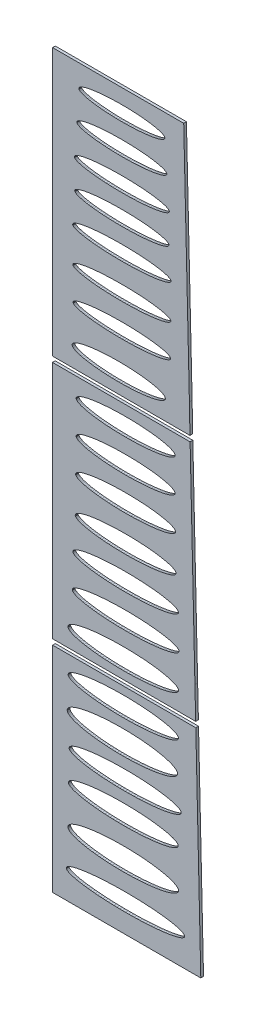
from build123d import *

# Parameters (mm, degrees)
EXTRUDE_1_DEPTH   = 1
EXTRUDE_1_2_DEPTH = 1
EXTRUDE_1_3_DEPTH = 1


with BuildPart() as part:
    # Model → 凸台-拉伸1 (new body)
    with BuildSketch(Plane.XY):
        Polygon((684.864186358, 730.85841127), (686.635417008, 654.440492915), (686.915945772, 642.85841127), (634.318878332, 642.85841127), (634.268367354, 730.85841127), align=None)
        Polygon((679.367985793, 723.772596316), (679.347985793, 723.611596316), (679.277985793, 723.452596316), (679.167985793, 723.293596316), (679.017985793, 723.135596316), (678.827985793, 722.979596316), (678.587985793, 722.824596316), (678.307985793, 722.672596316), (677.977985793, 722.523596316), (677.617985793, 722.376596316), (677.217985793, 722.233596316), (676.777985793, 722.094596316), (676.297985793, 721.958596316), (675.787985793, 721.827596316), (675.237985793, 721.701596316), (674.647985793, 721.580596316), (674.037985793, 721.464596316), (673.387985793, 721.353596316), (672.707985793, 721.249596316), (672.007985793, 721.150596316), (671.277985793, 721.058596316), (670.517985793, 720.972596316), (669.747985793, 720.893596316), (668.947985793, 720.821596316), (668.127985793, 720.756596316), (667.297985793, 720.699596316), (666.447985793, 720.648596316), (665.587985793, 720.606596316), (664.717985793, 720.570596316), (663.837985793, 720.543596316), (662.947985793, 720.523596316), (662.057985793, 720.512596316), (661.157985793, 720.508596316), (660.267985793, 720.512596316), (659.377985793, 720.523596316), (658.487985793, 720.543596316), (657.607985793, 720.570596316), (656.737985793, 720.606596316), (655.877985793, 720.648596316), (655.027985793, 720.699596316), (654.197985793, 720.756596316), (653.377985793, 720.821596316), (652.577985793, 720.893596316), (651.797985793, 720.972596316), (651.047985793, 721.058596316), (650.317985793, 721.150596316), (649.607985793, 721.249596316), (648.937985793, 721.353596316), (648.287985793, 721.464596316), (647.667985793, 721.580596316), (647.087985793, 721.701596316), (646.537985793, 721.827596316), (646.027985793, 721.958596316), (645.547985793, 722.094596316), (645.107985793, 722.233596316), (644.707985793, 722.376596316), (644.337985793, 722.523596316), (644.017985793, 722.672596316), (643.737985793, 722.824596316), (643.497985793, 722.979596316), (643.307985793, 723.135596316), (643.157985793, 723.293596316), (643.047985793, 723.452596316), (642.977985793, 723.611596316), (642.957985793, 723.772596316), (642.977985793, 723.932596316), (643.047985793, 724.091596316), (643.157985793, 724.250596316), (643.307985793, 724.408596316), (643.497985793, 724.565596316), (643.737985793, 724.719596316), (644.017985793, 724.871596316), (644.337985793, 725.021596316), (644.707985793, 725.167596316), (645.107985793, 725.310596316), (645.547985793, 725.449596316), (646.027985793, 725.585596316), (646.537985793, 725.716596316), (647.087985793, 725.842596316), (647.667985793, 725.963596316), (648.287985793, 726.079596316), (648.937985793, 726.190596316), (649.607985793, 726.294596316), (650.317985793, 726.393596316), (651.047985793, 726.485596316), (651.797985793, 726.571596316), (652.577985793, 726.650596316), (653.377985793, 726.722596316), (654.197985793, 726.787596316), (655.027985793, 726.845596316), (655.877985793, 726.895596316), (656.737985793, 726.938596316), (657.607985793, 726.973596316), (658.487985793, 727.000596316), (659.377985793, 727.020596316), (660.267985793, 727.031596316), (661.157985793, 727.035596316), (662.057985793, 727.031596316), (662.947985793, 727.020596316), (663.837985793, 727.000596316), (664.717985793, 726.973596316), (665.587985793, 726.938596316), (666.447985793, 726.895596316), (667.297985793, 726.845596316), (668.127985793, 726.787596316), (668.947985793, 726.722596316), (669.747985793, 726.650596316), (670.517985793, 726.571596316), (671.277985793, 726.485596316), (672.007985793, 726.393596316), (672.707985793, 726.294596316), (673.387985793, 726.190596316), (674.037985793, 726.079596316), (674.647985793, 725.963596316), (675.237985793, 725.842596316), (675.787985793, 725.716596316), (676.297985793, 725.585596316), (676.777985793, 725.449596316), (677.217985793, 725.310596316), (677.617985793, 725.167596316), (677.977985793, 725.021596316), (678.307985793, 724.871596316), (678.587985793, 724.719596316), (678.827985793, 724.565596316), (679.017985793, 724.408596316), (679.167985793, 724.250596316), (679.277985793, 724.091596316), (679.347985793, 723.932596316), align=None, mode=Mode.SUBTRACT)
        Polygon((679.367985793, 711.713596316), (679.347985793, 711.553596316), (679.277985793, 711.393596316), (679.167985793, 711.235596316), (679.017985793, 711.077596316), (678.827985793, 710.920596316), (678.587985793, 710.766596316), (678.307985793, 710.614596316), (677.977985793, 710.464596316), (677.617985793, 710.318596316), (677.217985793, 710.175596316), (676.777985793, 710.035596316), (676.297985793, 709.900596316), (675.787985793, 709.769596316), (675.237985793, 709.643596316), (674.647985793, 709.522596316), (674.037985793, 709.406596316), (673.387985793, 709.295596316), (672.707985793, 709.190596316), (672.007985793, 709.092596316), (671.277985793, 709.000596316), (670.517985793, 708.914596316), (669.747985793, 708.835596316), (668.947985793, 708.763596316), (668.127985793, 708.698596316), (667.297985793, 708.640596316), (666.447985793, 708.590596316), (665.587985793, 708.547596316), (664.717985793, 708.512596316), (663.837985793, 708.485596316), (662.947985793, 708.465596316), (662.057985793, 708.454596316), (661.157985793, 708.450596316), (660.267985793, 708.454596316), (659.377985793, 708.465596316), (658.487985793, 708.485596316), (657.607985793, 708.512596316), (656.737985793, 708.547596316), (655.877985793, 708.590596316), (655.027985793, 708.640596316), (654.197985793, 708.698596316), (653.377985793, 708.763596316), (652.577985793, 708.835596316), (651.797985793, 708.914596316), (651.047985793, 709.000596316), (650.317985793, 709.092596316), (649.607985793, 709.190596316), (648.937985793, 709.295596316), (648.287985793, 709.406596316), (647.667985793, 709.522596316), (647.087985793, 709.643596316), (646.537985793, 709.769596316), (646.027985793, 709.900596316), (645.547985793, 710.035596316), (645.107985793, 710.175596316), (644.707985793, 710.318596316), (644.337985793, 710.464596316), (644.017985793, 710.614596316), (643.737985793, 710.766596316), (643.497985793, 710.920596316), (643.307985793, 711.077596316), (643.157985793, 711.235596316), (643.047985793, 711.393596316), (642.977985793, 711.553596316), (642.957985793, 711.713596316), (642.977985793, 711.874596316), (643.047985793, 712.033596316), (643.157985793, 712.192596316), (643.307985793, 712.350596316), (643.497985793, 712.506596316), (643.737985793, 712.661596316), (644.017985793, 712.813596316), (644.337985793, 712.962596316), (644.707985793, 713.109596316), (645.107985793, 713.252596316), (645.547985793, 713.391596316), (646.027985793, 713.527596316), (646.537985793, 713.658596316), (647.087985793, 713.784596316), (647.667985793, 713.905596316), (648.287985793, 714.021596316), (648.937985793, 714.132596316), (649.607985793, 714.236596316), (650.317985793, 714.335596316), (651.047985793, 714.427596316), (651.797985793, 714.513596316), (652.577985793, 714.592596316), (653.377985793, 714.664596316), (654.197985793, 714.729596316), (655.027985793, 714.786596316), (655.877985793, 714.837596316), (656.737985793, 714.879596316), (657.607985793, 714.914596316), (658.487985793, 714.942596316), (659.377985793, 714.961596316), (660.267985793, 714.973596316), (661.157985793, 714.977596316), (662.057985793, 714.973596316), (662.947985793, 714.961596316), (663.837985793, 714.942596316), (664.717985793, 714.914596316), (665.587985793, 714.879596316), (666.447985793, 714.837596316), (667.297985793, 714.786596316), (668.127985793, 714.729596316), (668.947985793, 714.664596316), (669.747985793, 714.592596316), (670.517985793, 714.513596316), (671.277985793, 714.427596316), (672.007985793, 714.335596316), (672.707985793, 714.236596316), (673.387985793, 714.132596316), (674.037985793, 714.021596316), (674.647985793, 713.905596316), (675.237985793, 713.784596316), (675.787985793, 713.658596316), (676.297985793, 713.527596316), (676.777985793, 713.391596316), (677.217985793, 713.252596316), (677.617985793, 713.109596316), (677.977985793, 712.962596316), (678.307985793, 712.813596316), (678.587985793, 712.661596316), (678.827985793, 712.506596316), (679.017985793, 712.350596316), (679.167985793, 712.192596316), (679.277985793, 712.033596316), (679.347985793, 711.874596316), align=None, mode=Mode.SUBTRACT)
        Polygon((679.537985793, 699.534517948), (679.517985793, 699.373517948), (679.447985793, 699.214517948), (679.337985793, 699.055517948), (679.177985793, 698.897517948), (678.987985793, 698.741517948), (678.747985793, 698.586517948), (678.457985793, 698.434517948), (678.137985793, 698.285517948), (677.767985793, 698.138517948), (677.367985793, 697.995517948), (676.917985793, 697.856517948), (676.437985793, 697.720517948), (675.917985793, 697.589517948), (675.367985793, 697.463517948), (674.777985793, 697.342517948), (674.157985793, 697.226517948), (673.497985793, 697.115517948), (672.817985793, 697.011517948), (672.107985793, 696.912517948), (671.367985793, 696.820517948), (670.607985793, 696.734517948), (669.827985793, 696.655517948), (669.017985793, 696.583517948), (668.197985793, 696.518517948), (667.347985793, 696.461517948), (666.497985793, 696.410517948), (665.627985793, 696.368517948), (664.747985793, 696.333517948), (663.857985793, 696.305517948), (662.967985793, 696.286517948), (662.067985793, 696.274517948), (661.157985793, 696.270517948), (660.257985793, 696.274517948), (659.357985793, 696.286517948), (658.467985793, 696.305517948), (657.577985793, 696.333517948), (656.697985793, 696.368517948), (655.827985793, 696.410517948), (654.967985793, 696.461517948), (654.127985793, 696.518517948), (653.307985793, 696.583517948), (652.497985793, 696.655517948), (651.717985793, 696.734517948), (650.957985793, 696.820517948), (650.217985793, 696.912517948), (649.507985793, 697.011517948), (648.827985793, 697.115517948), (648.167985793, 697.226517948), (647.547985793, 697.342517948), (646.957985793, 697.463517948), (646.407985793, 697.589517948), (645.887985793, 697.720517948), (645.407985793, 697.856517948), (644.957985793, 697.995517948), (644.557985793, 698.138517948), (644.187985793, 698.285517948), (643.867985793, 698.434517948), (643.577985793, 698.586517948), (643.337985793, 698.741517948), (643.137985793, 698.897517948), (642.987985793, 699.055517948), (642.877985793, 699.214517948), (642.807985793, 699.373517948), (642.787985793, 699.534517948), (642.807985793, 699.694517948), (642.877985793, 699.853517948), (642.987985793, 700.012517948), (643.137985793, 700.170517948), (643.337985793, 700.327517948), (643.577985793, 700.481517948), (643.867985793, 700.633517948), (644.187985793, 700.783517948), (644.557985793, 700.929517948), (644.957985793, 701.072517948), (645.407985793, 701.211517948), (645.887985793, 701.347517948), (646.407985793, 701.478517948), (646.957985793, 701.604517948), (647.547985793, 701.725517948), (648.167985793, 701.841517948), (648.827985793, 701.952517948), (649.507985793, 702.056517948), (650.217985793, 702.155517948), (650.957985793, 702.247517948), (651.717985793, 702.333517948), (652.497985793, 702.412517948), (653.307985793, 702.484517948), (654.127985793, 702.549517948), (654.967985793, 702.607517948), (655.827985793, 702.657517948), (656.697985793, 702.700517948), (657.577985793, 702.735517948), (658.467985793, 702.762517948), (659.357985793, 702.782517948), (660.257985793, 702.793517948), (661.157985793, 702.797517948), (662.067985793, 702.793517948), (662.967985793, 702.782517948), (663.857985793, 702.762517948), (664.747985793, 702.735517948), (665.627985793, 702.700517948), (666.497985793, 702.657517948), (667.347985793, 702.607517948), (668.197985793, 702.549517948), (669.017985793, 702.484517948), (669.827985793, 702.412517948), (670.607985793, 702.333517948), (671.367985793, 702.247517948), (672.107985793, 702.155517948), (672.817985793, 702.056517948), (673.497985793, 701.952517948), (674.157985793, 701.841517948), (674.777985793, 701.725517948), (675.367985793, 701.604517948), (675.917985793, 701.478517948), (676.437985793, 701.347517948), (676.917985793, 701.211517948), (677.367985793, 701.072517948), (677.767985793, 700.929517948), (678.137985793, 700.783517948), (678.457985793, 700.633517948), (678.747985793, 700.481517948), (678.987985793, 700.327517948), (679.177985793, 700.170517948), (679.337985793, 700.012517948), (679.447985793, 699.853517948), (679.517985793, 699.694517948), align=None, mode=Mode.SUBTRACT)
        Polygon((679.697985793, 686.423478764), (679.677985793, 686.263478764), (679.617985793, 686.103478764), (679.497985793, 685.944478764), (679.347985793, 685.786478764), (679.147985793, 685.630478764), (678.907985793, 685.476478764), (678.617985793, 685.323478764), (678.287985793, 685.174478764), (677.917985793, 685.028478764), (677.517985793, 684.884478764), (677.067985793, 684.745478764), (676.577985793, 684.610478764), (676.057985793, 684.479478764), (675.497985793, 684.353478764), (674.897985793, 684.231478764), (674.267985793, 684.115478764), (673.617985793, 684.005478764), (672.927985793, 683.900478764), (672.207985793, 683.802478764), (671.457985793, 683.709478764), (670.697985793, 683.624478764), (669.897985793, 683.545478764), (669.087985793, 683.473478764), (668.257985793, 683.408478764), (667.407985793, 683.350478764), (666.547985793, 683.300478764), (665.667985793, 683.257478764), (664.777985793, 683.222478764), (663.877985793, 683.195478764), (662.977985793, 683.175478764), (662.067985793, 683.163478764), (661.157985793, 683.159478764), (660.247985793, 683.163478764), (659.347985793, 683.175478764), (658.437985793, 683.195478764), (657.547985793, 683.222478764), (656.657985793, 683.257478764), (655.777985793, 683.300478764), (654.917985793, 683.350478764), (654.067985793, 683.408478764), (653.237985793, 683.473478764), (652.417985793, 683.545478764), (651.627985793, 683.624478764), (650.857985793, 683.709478764), (650.117985793, 683.802478764), (649.397985793, 683.900478764), (648.707985793, 684.005478764), (648.047985793, 684.115478764), (647.427985793, 684.231478764), (646.827985793, 684.353478764), (646.267985793, 684.479478764), (645.747985793, 684.610478764), (645.257985793, 684.745478764), (644.807985793, 684.884478764), (644.397985793, 685.028478764), (644.037985793, 685.174478764), (643.707985793, 685.323478764), (643.417985793, 685.476478764), (643.177985793, 685.630478764), (642.977985793, 685.786478764), (642.827985793, 685.944478764), (642.707985793, 686.103478764), (642.647985793, 686.263478764), (642.617985793, 686.423478764), (642.647985793, 686.583478764), (642.707985793, 686.743478764), (642.827985793, 686.902478764), (642.977985793, 687.060478764), (643.177985793, 687.216478764), (643.417985793, 687.370478764), (643.707985793, 687.523478764), (644.037985793, 687.672478764), (644.397985793, 687.818478764), (644.807985793, 687.962478764), (645.257985793, 688.101478764), (645.747985793, 688.236478764), (646.267985793, 688.367478764), (646.827985793, 688.494478764), (647.427985793, 688.615478764), (648.047985793, 688.731478764), (648.707985793, 688.841478764), (649.397985793, 688.946478764), (650.117985793, 689.045478764), (650.857985793, 689.137478764), (651.627985793, 689.222478764), (652.417985793, 689.301478764), (653.237985793, 689.373478764), (654.067985793, 689.438478764), (654.917985793, 689.496478764), (655.777985793, 689.546478764), (656.657985793, 689.589478764), (657.547985793, 689.624478764), (658.437985793, 689.651478764), (659.347985793, 689.671478764), (660.247985793, 689.683478764), (661.157985793, 689.687478764), (662.067985793, 689.683478764), (662.977985793, 689.671478764), (663.877985793, 689.651478764), (664.777985793, 689.624478764), (665.667985793, 689.589478764), (666.547985793, 689.546478764), (667.407985793, 689.496478764), (668.257985793, 689.438478764), (669.087985793, 689.373478764), (669.897985793, 689.301478764), (670.697985793, 689.222478764), (671.457985793, 689.137478764), (672.207985793, 689.045478764), (672.927985793, 688.946478764), (673.617985793, 688.841478764), (674.267985793, 688.731478764), (674.897985793, 688.615478764), (675.497985793, 688.494478764), (676.057985793, 688.367478764), (676.577985793, 688.236478764), (677.067985793, 688.101478764), (677.517985793, 687.962478764), (677.917985793, 687.818478764), (678.287985793, 687.672478764), (678.617985793, 687.523478764), (678.907985793, 687.370478764), (679.147985793, 687.216478764), (679.347985793, 687.060478764), (679.497985793, 686.902478764), (679.617985793, 686.743478764), (679.677985793, 686.583478764), align=None, mode=Mode.SUBTRACT)
        Polygon((680.597985793, 674.382361212), (680.567985793, 674.222361212), (680.497985793, 674.063361212), (680.377985793, 673.904361212), (680.217985793, 673.746361212), (680.007985793, 673.589361212), (679.757985793, 673.435361212), (679.457985793, 673.283361212), (679.117985793, 673.133361212), (678.727985793, 672.987361212), (678.297985793, 672.844361212), (677.827985793, 672.705361212), (677.317985793, 672.569361212), (676.767985793, 672.438361212), (676.177985793, 672.312361212), (675.557985793, 672.191361212), (674.897985793, 672.075361212), (674.207985793, 671.964361212), (673.487985793, 671.860361212), (672.737985793, 671.761361212), (671.957985793, 671.669361212), (671.147985793, 671.583361212), (670.317985793, 671.504361212), (669.467985793, 671.432361212), (668.597985793, 671.367361212), (667.707985793, 671.309361212), (666.797985793, 671.259361212), (665.887985793, 671.217361212), (664.957985793, 671.181361212), (664.017985793, 671.154361212), (663.067985793, 671.134361212), (662.117985793, 671.123361212), (661.157985793, 671.119361212), (660.207985793, 671.123361212), (659.257985793, 671.134361212), (658.307985793, 671.154361212), (657.367985793, 671.181361212), (656.437985793, 671.217361212), (655.517985793, 671.259361212), (654.617985793, 671.309361212), (653.727985793, 671.367361212), (652.857985793, 671.432361212), (652.007985793, 671.504361212), (651.177985793, 671.583361212), (650.367985793, 671.669361212), (649.587985793, 671.761361212), (648.837985793, 671.860361212), (648.117985793, 671.964361212), (647.427985793, 672.075361212), (646.767985793, 672.191361212), (646.137985793, 672.312361212), (645.557985793, 672.438361212), (645.007985793, 672.569361212), (644.497985793, 672.705361212), (644.027985793, 672.844361212), (643.597985793, 672.987361212), (643.207985793, 673.133361212), (642.867985793, 673.283361212), (642.567985793, 673.435361212), (642.317985793, 673.589361212), (642.107985793, 673.746361212), (641.937985793, 673.904361212), (641.827985793, 674.063361212), (641.757985793, 674.222361212), (641.727985793, 674.382361212), (641.757985793, 674.543361212), (641.827985793, 674.702361212), (641.937985793, 674.861361212), (642.107985793, 675.019361212), (642.317985793, 675.175361212), (642.567985793, 675.330361212), (642.867985793, 675.482361212), (643.207985793, 675.631361212), (643.597985793, 675.778361212), (644.027985793, 675.921361212), (644.497985793, 676.060361212), (645.007985793, 676.196361212), (645.557985793, 676.327361212), (646.137985793, 676.453361212), (646.767985793, 676.574361212), (647.427985793, 676.690361212), (648.117985793, 676.801361212), (648.837985793, 676.905361212), (649.587985793, 677.004361212), (650.367985793, 677.096361212), (651.177985793, 677.182361212), (652.007985793, 677.261361212), (652.857985793, 677.333361212), (653.727985793, 677.398361212), (654.617985793, 677.455361212), (655.517985793, 677.506361212), (656.437985793, 677.548361212), (657.367985793, 677.584361212), (658.307985793, 677.611361212), (659.257985793, 677.631361212), (660.207985793, 677.642361212), (661.157985793, 677.646361212), (662.117985793, 677.642361212), (663.067985793, 677.631361212), (664.017985793, 677.611361212), (664.957985793, 677.584361212), (665.887985793, 677.548361212), (666.797985793, 677.506361212), (667.707985793, 677.455361212), (668.597985793, 677.398361212), (669.467985793, 677.333361212), (670.317985793, 677.261361212), (671.147985793, 677.182361212), (671.957985793, 677.096361212), (672.737985793, 677.004361212), (673.487985793, 676.905361212), (674.207985793, 676.801361212), (674.897985793, 676.690361212), (675.557985793, 676.574361212), (676.177985793, 676.453361212), (676.767985793, 676.327361212), (677.317985793, 676.196361212), (677.827985793, 676.060361212), (678.297985793, 675.921361212), (678.727985793, 675.778361212), (679.117985793, 675.631361212), (679.457985793, 675.482361212), (679.757985793, 675.330361212), (680.007985793, 675.175361212), (680.217985793, 675.019361212), (680.377985793, 674.861361212), (680.497985793, 674.702361212), (680.567985793, 674.543361212), align=None, mode=Mode.SUBTRACT)
        Polygon((680.787985793, 662.12624366), (680.767985793, 661.96624366), (680.697985793, 661.80624366), (680.577985793, 661.64724366), (680.417985793, 661.49024366), (680.207985793, 661.33324366), (679.947985793, 661.17924366), (679.647985793, 661.02724366), (679.297985793, 660.87724366), (678.907985793, 660.73124366), (678.477985793, 660.58824366), (677.997985793, 660.44824366), (677.487985793, 660.31324366), (676.927985793, 660.18224366), (676.337985793, 660.05624366), (675.707985793, 659.93524366), (675.037985793, 659.81924366), (674.347985793, 659.70824366), (673.617985793, 659.60324366), (672.857985793, 659.50524366), (672.067985793, 659.41324366), (671.257985793, 659.32724366), (670.417985793, 659.24824366), (669.557985793, 659.17624366), (668.677985793, 659.11124366), (667.777985793, 659.05324366), (666.857985793, 659.00324366), (665.927985793, 658.96024366), (664.987985793, 658.92524366), (664.037985793, 658.89824366), (663.087985793, 658.87824366), (662.127985793, 658.86724366), (661.157985793, 658.86324366), (660.197985793, 658.86724366), (659.237985793, 658.87824366), (658.277985793, 658.89824366), (657.337985793, 658.92524366), (656.397985793, 658.96024366), (655.467985793, 659.00324366), (654.547985793, 659.05324366), (653.647985793, 659.11124366), (652.767985793, 659.17624366), (651.907985793, 659.24824366), (651.067985793, 659.32724366), (650.257985793, 659.41324366), (649.467985793, 659.50524366), (648.707985793, 659.60324366), (647.977985793, 659.70824366), (647.277985793, 659.81924366), (646.617985793, 659.93524366), (645.987985793, 660.05624366), (645.397985793, 660.18224366), (644.837985793, 660.31324366), (644.327985793, 660.44824366), (643.847985793, 660.58824366), (643.417985793, 660.73124366), (643.027985793, 660.87724366), (642.677985793, 661.02724366), (642.377985793, 661.17924366), (642.117985793, 661.33324366), (641.907985793, 661.49024366), (641.747985793, 661.64724366), (641.627985793, 661.80624366), (641.557985793, 661.96624366), (641.537985793, 662.12624366), (641.557985793, 662.28624366), (641.627985793, 662.44624366), (641.747985793, 662.60524366), (641.907985793, 662.76324366), (642.117985793, 662.91924366), (642.377985793, 663.07424366), (642.677985793, 663.22624366), (643.027985793, 663.37524366), (643.417985793, 663.52224366), (643.847985793, 663.66524366), (644.327985793, 663.80424366), (644.837985793, 663.94024366), (645.397985793, 664.07124366), (645.987985793, 664.19724366), (646.617985793, 664.31824366), (647.277985793, 664.43424366), (647.977985793, 664.54524366), (648.707985793, 664.64924366), (649.467985793, 664.74824366), (650.257985793, 664.84024366), (651.067985793, 664.92624366), (651.907985793, 665.00524366), (652.767985793, 665.07724366), (653.647985793, 665.14224366), (654.547985793, 665.19924366), (655.467985793, 665.25024366), (656.397985793, 665.29224366), (657.337985793, 665.32724366), (658.277985793, 665.35524366), (659.237985793, 665.37424366), (660.197985793, 665.38624366), (661.157985793, 665.39024366), (662.127985793, 665.38624366), (663.087985793, 665.37424366), (664.037985793, 665.35524366), (664.987985793, 665.32724366), (665.927985793, 665.29224366), (666.857985793, 665.25024366), (667.777985793, 665.19924366), (668.677985793, 665.14224366), (669.557985793, 665.07724366), (670.417985793, 665.00524366), (671.257985793, 664.92624366), (672.067985793, 664.84024366), (672.857985793, 664.74824366), (673.617985793, 664.64924366), (674.347985793, 664.54524366), (675.037985793, 664.43424366), (675.707985793, 664.31824366), (676.337985793, 664.19724366), (676.927985793, 664.07124366), (677.487985793, 663.94024366), (677.997985793, 663.80424366), (678.477985793, 663.66524366), (678.907985793, 663.52224366), (679.297985793, 663.37524366), (679.647985793, 663.22624366), (679.947985793, 663.07424366), (680.207985793, 662.91924366), (680.417985793, 662.76324366), (680.577985793, 662.60524366), (680.697985793, 662.44624366), (680.767985793, 662.28624366), align=None, mode=Mode.SUBTRACT)
        Polygon((639.906209286, 649.576387755), (639.926209286, 649.763387755), (640.006209286, 649.949387755), (640.126209286, 650.135387755), (640.296209286, 650.319387755), (640.516209286, 650.502387755), (640.786209286, 650.682387755), (641.096209286, 650.860387755), (641.456209286, 651.035387755), (641.856209286, 651.206387755), (642.306209286, 651.373387755), (642.796209286, 651.536387755), (643.336209286, 651.694387755), (643.906209286, 651.847387755), (644.526209286, 651.994387755), (645.176209286, 652.136387755), (645.866209286, 652.272387755), (646.586209286, 652.401387755), (647.346209286, 652.523387755), (648.136209286, 652.638387755), (648.946209286, 652.746387755), (649.796209286, 652.846387755), (650.666209286, 652.938387755), (651.556209286, 653.022387755), (652.466209286, 653.098387755), (653.396209286, 653.165387755), (654.346209286, 653.224387755), (655.306209286, 653.274387755), (656.286209286, 653.315387755), (657.266209286, 653.347387755), (658.256209286, 653.370387755), (659.256209286, 653.384387755), (660.256209286, 653.388387755), (661.256209286, 653.384387755), (662.246209286, 653.370387755), (663.236209286, 653.347387755), (664.226209286, 653.315387755), (665.196209286, 653.274387755), (666.166209286, 653.224387755), (667.106209286, 653.165387755), (668.046209286, 653.098387755), (668.956209286, 653.022387755), (669.846209286, 652.938387755), (670.716209286, 652.846387755), (671.556209286, 652.746387755), (672.376209286, 652.638387755), (673.166209286, 652.523387755), (673.916209286, 652.401387755), (674.646209286, 652.272387755), (675.336209286, 652.136387755), (675.986209286, 651.994387755), (676.596209286, 651.847387755), (677.176209286, 651.694387755), (677.706209286, 651.536387755), (678.196209286, 651.373387755), (678.646209286, 651.206387755), (679.056209286, 651.035387755), (679.416209286, 650.860387755), (679.726209286, 650.682387755), (679.996209286, 650.502387755), (680.216209286, 650.319387755), (680.386209286, 650.135387755), (680.506209286, 649.949387755), (680.576209286, 649.763387755), (680.606209286, 649.576387755), (680.576209286, 649.389387755), (680.506209286, 649.202387755), (680.386209286, 649.016387755), (680.216209286, 648.832387755), (679.996209286, 648.649387755), (679.726209286, 648.469387755), (679.416209286, 648.291387755), (679.056209286, 648.117387755), (678.646209286, 647.945387755), (678.196209286, 647.778387755), (677.706209286, 647.616387755), (677.176209286, 647.457387755), (676.596209286, 647.304387755), (675.986209286, 647.157387755), (675.336209286, 647.015387755), (674.646209286, 646.880387755), (673.916209286, 646.751387755), (673.166209286, 646.628387755), (672.376209286, 646.513387755), (671.556209286, 646.406387755), (670.716209286, 646.305387755), (669.846209286, 646.213387755), (668.956209286, 646.129387755), (668.046209286, 646.053387755), (667.106209286, 645.986387755), (666.166209286, 645.927387755), (665.196209286, 645.877387755), (664.226209286, 645.836387755), (663.236209286, 645.804387755), (662.246209286, 645.781387755), (661.256209286, 645.768387755), (660.256209286, 645.763387755), (659.256209286, 645.768387755), (658.256209286, 645.781387755), (657.266209286, 645.804387755), (656.286209286, 645.836387755), (655.306209286, 645.877387755), (654.346209286, 645.927387755), (653.396209286, 645.986387755), (652.466209286, 646.053387755), (651.556209286, 646.129387755), (650.666209286, 646.213387755), (649.796209286, 646.305387755), (648.946209286, 646.406387755), (648.136209286, 646.513387755), (647.346209286, 646.628387755), (646.586209286, 646.751387755), (645.866209286, 646.880387755), (645.176209286, 647.015387755), (644.526209286, 647.157387755), (643.906209286, 647.304387755), (643.336209286, 647.457387755), (642.796209286, 647.616387755), (642.306209286, 647.778387755), (641.856209286, 647.945387755), (641.456209286, 648.117387755), (641.096209286, 648.291387755), (640.786209286, 648.469387755), (640.516209286, 648.649387755), (640.296209286, 648.832387755), (640.126209286, 649.016387755), (640.006209286, 649.202387755), (639.926209286, 649.389387755), align=None, mode=Mode.SUBTRACT)
    extrude(amount=EXTRUDE_1_DEPTH)


with BuildPart() as body_2:
    # Model → Extrude 1 2 (new body)
    with BuildSketch(Plane.XY):
        Polygon((634.268367354, 732.85841127), (684.802380972, 732.85841127), (684.604210693, 743.48369558), (682.512393372, 831.108332524), (634.307655364, 831.108332524), align=None)
        Polygon((675.77913377, 740.070596316), (675.75913377, 739.910596316), (675.69913377, 739.750596316), (675.59913377, 739.592596316), (675.44913377, 739.434596316), (675.26913377, 739.277596316), (675.03913377, 739.123596316), (674.77913377, 738.971596316), (674.47913377, 738.821596316), (674.12913377, 738.675596316), (673.75913377, 738.532596316), (673.33913377, 738.392596316), (672.88913377, 738.257596316), (672.40913377, 738.126596316), (671.88913377, 738.000596316), (671.33913377, 737.879596316), (670.75913377, 737.763596316), (670.14913377, 737.652596316), (669.50913377, 737.547596316), (668.84913377, 737.449596316), (668.15913377, 737.357596316), (667.44913377, 737.271596316), (666.70913377, 737.192596316), (665.95913377, 737.120596316), (665.18913377, 737.055596316), (664.40913377, 736.997596316), (663.60913377, 736.947596316), (662.79913377, 736.904596316), (661.97913377, 736.869596316), (661.14913377, 736.842596316), (660.30913377, 736.822596316), (659.46913377, 736.811596316), (658.62913377, 736.807596316), (657.78913377, 736.811596316), (656.94913377, 736.822596316), (656.10913377, 736.842596316), (655.27913377, 736.869596316), (654.45913377, 736.904596316), (653.64913377, 736.947596316), (652.84913377, 736.997596316), (652.06913377, 737.055596316), (651.29913377, 737.120596316), (650.53913377, 737.192596316), (649.80913377, 737.271596316), (649.09913377, 737.357596316), (648.40913377, 737.449596316), (647.74913377, 737.547596316), (647.10913377, 737.652596316), (646.49913377, 737.763596316), (645.91913377, 737.879596316), (645.36913377, 738.000596316), (644.84913377, 738.126596316), (644.36913377, 738.257596316), (643.91913377, 738.392596316), (643.49913377, 738.532596316), (643.12913377, 738.675596316), (642.77913377, 738.821596316), (642.47913377, 738.971596316), (642.21913377, 739.123596316), (641.98913377, 739.277596316), (641.80913377, 739.434596316), (641.65913377, 739.592596316), (641.55913377, 739.750596316), (641.49913377, 739.910596316), (641.47913377, 740.070596316), (641.49913377, 740.231596316), (641.55913377, 740.390596316), (641.65913377, 740.549596316), (641.80913377, 740.707596316), (641.98913377, 740.863596316), (642.21913377, 741.018596316), (642.47913377, 741.170596316), (642.77913377, 741.319596316), (643.12913377, 741.466596316), (643.49913377, 741.609596316), (643.91913377, 741.748596316), (644.36913377, 741.884596316), (644.84913377, 742.015596316), (645.36913377, 742.141596316), (645.91913377, 742.262596316), (646.49913377, 742.378596316), (647.10913377, 742.489596316), (647.74913377, 742.593596316), (648.40913377, 742.692596316), (649.09913377, 742.784596316), (649.80913377, 742.870596316), (650.53913377, 742.949596316), (651.29913377, 743.021596316), (652.06913377, 743.086596316), (652.84913377, 743.143596316), (653.64913377, 743.194596316), (654.45913377, 743.236596316), (655.27913377, 743.271596316), (656.10913377, 743.299596316), (656.94913377, 743.318596316), (657.78913377, 743.330596316), (658.62913377, 743.334596316), (659.46913377, 743.330596316), (660.30913377, 743.318596316), (661.14913377, 743.299596316), (661.97913377, 743.271596316), (662.79913377, 743.236596316), (663.60913377, 743.194596316), (664.40913377, 743.143596316), (665.18913377, 743.086596316), (665.95913377, 743.021596316), (666.70913377, 742.949596316), (667.44913377, 742.870596316), (668.15913377, 742.784596316), (668.84913377, 742.692596316), (669.50913377, 742.593596316), (670.14913377, 742.489596316), (670.75913377, 742.378596316), (671.33913377, 742.262596316), (671.88913377, 742.141596316), (672.40913377, 742.015596316), (672.88913377, 741.884596316), (673.33913377, 741.748596316), (673.75913377, 741.609596316), (674.12913377, 741.466596316), (674.47913377, 741.319596316), (674.77913377, 741.170596316), (675.03913377, 741.018596316), (675.26913377, 740.863596316), (675.44913377, 740.707596316), (675.59913377, 740.549596316), (675.69913377, 740.390596316), (675.75913377, 740.231596316), align=None, mode=Mode.SUBTRACT)
        Polygon((643.925305775, 822.939027858), (643.945305775, 823.072027858), (643.995305775, 823.204027858), (644.095305775, 823.335027858), (644.225305775, 823.466027858), (644.395305775, 823.595027858), (644.605305775, 823.723027858), (644.845305775, 823.849027858), (645.125305775, 823.972027858), (645.445305775, 824.094027858), (645.795305775, 824.212027858), (646.175305775, 824.327027858), (646.595305775, 824.439027858), (647.045305775, 824.548027858), (647.515305775, 824.652027858), (648.025305775, 824.752027858), (648.565305775, 824.848027858), (649.125305775, 824.940027858), (649.715305775, 825.026027858), (650.325305775, 825.108027858), (650.965305775, 825.184027858), (651.625305775, 825.255027858), (652.295305775, 825.320027858), (652.995305775, 825.380027858), (653.705305775, 825.433027858), (654.425305775, 825.481027858), (655.165305775, 825.523027858), (655.915305775, 825.558027858), (656.675305775, 825.587027858), (657.435305775, 825.610027858), (658.215305775, 825.626027858), (658.985305775, 825.636027858), (659.765305775, 825.639027858), (660.545305775, 825.636027858), (661.315305775, 825.626027858), (662.085305775, 825.610027858), (662.855305775, 825.587027858), (663.615305775, 825.558027858), (664.365305775, 825.523027858), (665.105305775, 825.481027858), (665.825305775, 825.433027858), (666.535305775, 825.380027858), (667.235305775, 825.320027858), (667.905305775, 825.255027858), (668.565305775, 825.184027858), (669.195305775, 825.108027858), (669.815305775, 825.026027858), (670.405305775, 824.940027858), (670.965305775, 824.848027858), (671.505305775, 824.752027858), (672.005305775, 824.652027858), (672.485305775, 824.548027858), (672.935305775, 824.439027858), (673.355305775, 824.327027858), (673.735305775, 824.212027858), (674.085305775, 824.094027858), (674.395305775, 823.972027858), (674.675305775, 823.849027858), (674.925305775, 823.723027858), (675.125305775, 823.595027858), (675.295305775, 823.466027858), (675.435305775, 823.335027858), (675.525305775, 823.204027858), (675.585305775, 823.072027858), (675.605305775, 822.939027858), (675.585305775, 822.807027858), (675.525305775, 822.675027858), (675.435305775, 822.543027858), (675.295305775, 822.413027858), (675.125305775, 822.283027858), (674.925305775, 822.156027858), (674.675305775, 822.030027858), (674.395305775, 821.906027858), (674.085305775, 821.785027858), (673.735305775, 821.667027858), (673.355305775, 821.551027858), (672.935305775, 821.440027858), (672.485305775, 821.331027858), (672.005305775, 821.227027858), (671.505305775, 821.126027858), (670.965305775, 821.030027858), (670.405305775, 820.939027858), (669.815305775, 820.853027858), (669.195305775, 820.771027858), (668.565305775, 820.695027858), (667.905305775, 820.624027858), (667.235305775, 820.559027858), (666.535305775, 820.499027858), (665.825305775, 820.445027858), (665.105305775, 820.398027858), (664.365305775, 820.356027858), (663.615305775, 820.321027858), (662.855305775, 820.292027858), (662.085305775, 820.269027858), (661.315305775, 820.253027858), (660.545305775, 820.243027858), (659.765305775, 820.240027858), (658.985305775, 820.243027858), (658.215305775, 820.253027858), (657.435305775, 820.269027858), (656.675305775, 820.292027858), (655.915305775, 820.321027858), (655.165305775, 820.356027858), (654.425305775, 820.398027858), (653.705305775, 820.445027858), (652.995305775, 820.499027858), (652.295305775, 820.559027858), (651.625305775, 820.624027858), (650.965305775, 820.695027858), (650.325305775, 820.771027858), (649.715305775, 820.853027858), (649.125305775, 820.939027858), (648.565305775, 821.030027858), (648.025305775, 821.126027858), (647.515305775, 821.227027858), (647.045305775, 821.331027858), (646.595305775, 821.440027858), (646.175305775, 821.551027858), (645.795305775, 821.667027858), (645.445305775, 821.785027858), (645.125305775, 821.906027858), (644.845305775, 822.030027858), (644.605305775, 822.156027858), (644.395305775, 822.283027858), (644.225305775, 822.413027858), (644.095305775, 822.543027858), (643.995305775, 822.675027858), (643.945305775, 822.807027858), align=None, mode=Mode.SUBTRACT)
        Polygon((643.225305775, 811.844302202), (643.235305775, 811.976302202), (643.295305775, 812.108302202), (643.395305775, 812.240302202), (643.535305775, 812.370302202), (643.715305775, 812.500302202), (643.935305775, 812.627302202), (644.185305775, 812.753302202), (644.475305775, 812.877302202), (644.805305775, 812.998302202), (645.175305775, 813.116302202), (645.575305775, 813.232302202), (646.005305775, 813.344302202), (646.475305775, 813.452302202), (646.975305775, 813.556302202), (647.505305775, 813.657302202), (648.065305775, 813.753302202), (648.655305775, 813.844302202), (649.265305775, 813.931302202), (649.905305775, 814.012302202), (650.575305775, 814.088302202), (651.255305775, 814.159302202), (651.965305775, 814.225302202), (652.695305775, 814.284302202), (653.435305775, 814.338302202), (654.195305775, 814.386302202), (654.965305775, 814.427302202), (655.745305775, 814.462302202), (656.535305775, 814.491302202), (657.335305775, 814.514302202), (658.145305775, 814.530302202), (658.955305775, 814.540302202), (659.765305775, 814.543302202), (660.575305775, 814.540302202), (661.385305775, 814.530302202), (662.195305775, 814.514302202), (662.995305775, 814.491302202), (663.785305775, 814.462302202), (664.565305775, 814.427302202), (665.335305775, 814.386302202), (666.095305775, 814.338302202), (666.835305775, 814.284302202), (667.565305775, 814.225302202), (668.265305775, 814.159302202), (668.955305775, 814.088302202), (669.615305775, 814.012302202), (670.255305775, 813.931302202), (670.875305775, 813.844302202), (671.465305775, 813.753302202), (672.025305775, 813.657302202), (672.555305775, 813.556302202), (673.055305775, 813.452302202), (673.515305775, 813.344302202), (673.955305775, 813.232302202), (674.355305775, 813.116302202), (674.715305775, 812.998302202), (675.045305775, 812.877302202), (675.345305775, 812.753302202), (675.595305775, 812.627302202), (675.815305775, 812.500302202), (675.985305775, 812.370302202), (676.125305775, 812.240302202), (676.225305775, 812.108302202), (676.285305775, 811.976302202), (676.305305775, 811.844302202), (676.285305775, 811.711302202), (676.225305775, 811.579302202), (676.125305775, 811.448302202), (675.985305775, 811.317302202), (675.815305775, 811.188302202), (675.595305775, 811.060302202), (675.345305775, 810.934302202), (675.045305775, 810.811302202), (674.715305775, 810.689302202), (674.355305775, 810.571302202), (673.955305775, 810.456302202), (673.515305775, 810.344302202), (673.055305775, 810.236302202), (672.555305775, 810.131302202), (672.025305775, 810.031302202), (671.465305775, 809.935302202), (670.875305775, 809.843302202), (670.255305775, 809.757302202), (669.615305775, 809.675302202), (668.955305775, 809.599302202), (668.265305775, 809.528302202), (667.565305775, 809.463302202), (666.835305775, 809.403302202), (666.095305775, 809.350302202), (665.335305775, 809.302302202), (664.565305775, 809.260302202), (663.785305775, 809.225302202), (662.995305775, 809.196302202), (662.195305775, 809.173302202), (661.385305775, 809.157302202), (660.575305775, 809.147302202), (659.765305775, 809.144302202), (658.955305775, 809.147302202), (658.145305775, 809.157302202), (657.335305775, 809.173302202), (656.535305775, 809.196302202), (655.745305775, 809.225302202), (654.965305775, 809.260302202), (654.195305775, 809.302302202), (653.435305775, 809.350302202), (652.695305775, 809.403302202), (651.965305775, 809.463302202), (651.255305775, 809.528302202), (650.575305775, 809.599302202), (649.905305775, 809.675302202), (649.265305775, 809.757302202), (648.655305775, 809.843302202), (648.065305775, 809.935302202), (647.505305775, 810.031302202), (646.975305775, 810.131302202), (646.475305775, 810.236302202), (646.005305775, 810.344302202), (645.575305775, 810.456302202), (645.175305775, 810.571302202), (644.805305775, 810.689302202), (644.475305775, 810.811302202), (644.185305775, 810.934302202), (643.935305775, 811.060302202), (643.715305775, 811.188302202), (643.535305775, 811.317302202), (643.395305775, 811.448302202), (643.295305775, 811.579302202), (643.235305775, 811.711302202), align=None, mode=Mode.SUBTRACT)
        Polygon((642.305305775, 800.365576546), (642.325305775, 800.498576546), (642.385305775, 800.630576546), (642.495305775, 800.762576546), (642.645305775, 800.892576546), (642.825305775, 801.021576546), (643.055305775, 801.149576546), (643.325305775, 801.275576546), (643.635305775, 801.398576546), (643.985305775, 801.520576546), (644.365305775, 801.638576546), (644.785305775, 801.753576546), (645.245305775, 801.865576546), (645.745305775, 801.974576546), (646.265305775, 802.078576546), (646.825305775, 802.178576546), (647.415305775, 802.274576546), (648.035305775, 802.366576546), (648.685305775, 802.452576546), (649.365305775, 802.534576546), (650.065305775, 802.610576546), (650.785305775, 802.681576546), (651.535305775, 802.746576546), (652.295305775, 802.806576546), (653.085305775, 802.860576546), (653.885305775, 802.907576546), (654.695305775, 802.949576546), (655.525305775, 802.984576546), (656.355305775, 803.013576546), (657.205305775, 803.036576546), (658.055305775, 803.052576546), (658.905305775, 803.062576546), (659.765305775, 803.065576546), (660.625305775, 803.062576546), (661.475305775, 803.052576546), (662.325305775, 803.036576546), (663.165305775, 803.013576546), (664.005305775, 802.984576546), (664.835305775, 802.949576546), (665.645305775, 802.907576546), (666.445305775, 802.860576546), (667.225305775, 802.806576546), (667.995305775, 802.746576546), (668.735305775, 802.681576546), (669.465305775, 802.610576546), (670.165305775, 802.534576546), (670.835305775, 802.452576546), (671.485305775, 802.366576546), (672.105305775, 802.274576546), (672.695305775, 802.178576546), (673.255305775, 802.078576546), (673.785305775, 801.974576546), (674.275305775, 801.865576546), (674.735305775, 801.753576546), (675.165305775, 801.638576546), (675.545305775, 801.520576546), (675.895305775, 801.398576546), (676.205305775, 801.275576546), (676.475305775, 801.149576546), (676.695305775, 801.021576546), (676.885305775, 800.892576546), (677.035305775, 800.762576546), (677.135305775, 800.630576546), (677.205305775, 800.498576546), (677.225305775, 800.365576546), (677.205305775, 800.233576546), (677.135305775, 800.101576546), (677.035305775, 799.969576546), (676.885305775, 799.839576546), (676.695305775, 799.709576546), (676.475305775, 799.582576546), (676.205305775, 799.456576546), (675.895305775, 799.332576546), (675.545305775, 799.211576546), (675.165305775, 799.093576546), (674.735305775, 798.978576546), (674.275305775, 798.866576546), (673.785305775, 798.757576546), (673.255305775, 798.653576546), (672.695305775, 798.552576546), (672.105305775, 798.456576546), (671.485305775, 798.365576546), (670.835305775, 798.279576546), (670.165305775, 798.197576546), (669.465305775, 798.121576546), (668.735305775, 798.050576546), (667.995305775, 797.985576546), (667.225305775, 797.925576546), (666.445305775, 797.871576546), (665.645305775, 797.824576546), (664.835305775, 797.782576546), (664.005305775, 797.747576546), (663.165305775, 797.718576546), (662.325305775, 797.695576546), (661.475305775, 797.679576546), (660.625305775, 797.669576546), (659.765305775, 797.666576546), (658.905305775, 797.669576546), (658.055305775, 797.679576546), (657.205305775, 797.695576546), (656.355305775, 797.718576546), (655.525305775, 797.747576546), (654.695305775, 797.782576546), (653.885305775, 797.824576546), (653.085305775, 797.871576546), (652.295305775, 797.925576546), (651.535305775, 797.985576546), (650.785305775, 798.050576546), (650.065305775, 798.121576546), (649.365305775, 798.197576546), (648.685305775, 798.279576546), (648.035305775, 798.365576546), (647.415305775, 798.456576546), (646.825305775, 798.552576546), (646.265305775, 798.653576546), (645.745305775, 798.757576546), (645.245305775, 798.866576546), (644.785305775, 798.978576546), (644.365305775, 799.093576546), (643.985305775, 799.211576546), (643.635305775, 799.332576546), (643.325305775, 799.456576546), (643.055305775, 799.582576546), (642.825305775, 799.709576546), (642.645305775, 799.839576546), (642.495305775, 799.969576546), (642.385305775, 800.101576546), (642.325305775, 800.233576546), align=None, mode=Mode.SUBTRACT)
        Polygon((642.445305775, 789.61585089), (642.465305775, 789.74785089), (642.525305775, 789.88085089), (642.635305775, 790.01185089), (642.775305775, 790.14285089), (642.965305775, 790.27185089), (643.195305775, 790.39985089), (643.455305775, 790.52485089), (643.765305775, 790.64885089), (644.105305775, 790.76985089), (644.495305775, 790.88885089), (644.915305775, 791.00385089), (645.365305775, 791.11585089), (645.855305775, 791.22385089), (646.375305775, 791.32885089), (646.935305775, 791.42885089), (647.515305775, 791.52485089), (648.135305775, 791.61585089), (648.775305775, 791.70285089), (649.445305775, 791.78385089), (650.145305775, 791.86085089), (650.865305775, 791.93185089), (651.605305775, 791.99685089), (652.355305775, 792.05585089), (653.135305775, 792.10985089), (653.925305775, 792.15785089), (654.735305775, 792.19885089), (655.555305775, 792.23485089), (656.385305775, 792.26385089), (657.225305775, 792.28585089), (658.065305775, 792.30285089), (658.915305775, 792.31185089), (659.765305775, 792.31585089), (660.615305775, 792.31185089), (661.465305775, 792.30285089), (662.305305775, 792.28585089), (663.145305775, 792.26385089), (663.975305775, 792.23485089), (664.795305775, 792.19885089), (665.595305775, 792.15785089), (666.395305775, 792.10985089), (667.165305775, 792.05585089), (667.925305775, 791.99685089), (668.665305775, 791.93185089), (669.385305775, 791.86085089), (670.075305775, 791.78385089), (670.755305775, 791.70285089), (671.395305775, 791.61585089), (672.005305775, 791.52485089), (672.595305775, 791.42885089), (673.155305775, 791.32885089), (673.675305775, 791.22385089), (674.165305775, 791.11585089), (674.615305775, 791.00385089), (675.035305775, 790.88885089), (675.415305775, 790.76985089), (675.765305775, 790.64885089), (676.065305775, 790.52485089), (676.335305775, 790.39985089), (676.565305775, 790.27185089), (676.745305775, 790.14285089), (676.895305775, 790.01185089), (676.995305775, 789.88085089), (677.065305775, 789.74785089), (677.085305775, 789.61585089), (677.065305775, 789.48385089), (676.995305775, 789.35085089), (676.895305775, 789.21985089), (676.745305775, 789.08885089), (676.565305775, 788.95985089), (676.335305775, 788.83185089), (676.065305775, 788.70585089), (675.765305775, 788.58285089), (675.415305775, 788.46185089), (675.035305775, 788.34285089), (674.615305775, 788.22785089), (674.165305775, 788.11585089), (673.675305775, 788.00785089), (673.155305775, 787.90285089), (672.595305775, 787.80285089), (672.005305775, 787.70685089), (671.395305775, 787.61585089), (670.755305775, 787.52885089), (670.075305775, 787.44785089), (669.385305775, 787.37085089), (668.665305775, 787.29985089), (667.925305775, 787.23485089), (667.165305775, 787.17585089), (666.395305775, 787.12185089), (665.595305775, 787.07385089), (664.795305775, 787.03285089), (663.975305775, 786.99685089), (663.145305775, 786.96785089), (662.305305775, 786.94585089), (661.465305775, 786.92885089), (660.615305775, 786.91985089), (659.765305775, 786.91585089), (658.915305775, 786.91985089), (658.065305775, 786.92885089), (657.225305775, 786.94585089), (656.385305775, 786.96785089), (655.555305775, 786.99685089), (654.735305775, 787.03285089), (653.925305775, 787.07385089), (653.135305775, 787.12185089), (652.355305775, 787.17585089), (651.605305775, 787.23485089), (650.865305775, 787.29985089), (650.145305775, 787.37085089), (649.445305775, 787.44785089), (648.775305775, 787.52885089), (648.135305775, 787.61585089), (647.515305775, 787.70685089), (646.935305775, 787.80285089), (646.375305775, 787.90285089), (645.855305775, 788.00785089), (645.365305775, 788.11585089), (644.915305775, 788.22785089), (644.495305775, 788.34285089), (644.105305775, 788.46185089), (643.765305775, 788.58285089), (643.455305775, 788.70585089), (643.195305775, 788.83185089), (642.965305775, 788.95985089), (642.775305775, 789.08885089), (642.635305775, 789.21985089), (642.525305775, 789.35085089), (642.465305775, 789.48385089), align=None, mode=Mode.SUBTRACT)
        Polygon((641.675305775, 778.509988062), (641.695305775, 778.642988062), (641.755305775, 778.774988062), (641.865305775, 778.905988062), (642.025305775, 779.036988062), (642.215305775, 779.165988062), (642.455305775, 779.293988062), (642.725305775, 779.419988062), (643.045305775, 779.542988062), (643.405305775, 779.664988062), (643.805305775, 779.782988062), (644.245305775, 779.897988062), (644.725305775, 780.009988062), (645.235305775, 780.118988062), (645.775305775, 780.222988062), (646.355305775, 780.322988062), (646.975305775, 780.418988062), (647.615305775, 780.510988062), (648.285305775, 780.596988062), (648.985305775, 780.678988062), (649.715305775, 780.754988062), (650.465305775, 780.825988062), (651.235305775, 780.890988062), (652.025305775, 780.950988062), (652.845305775, 781.003988062), (653.665305775, 781.051988062), (654.515305775, 781.093988062), (655.365305775, 781.128988062), (656.235305775, 781.157988062), (657.105305775, 781.180988062), (657.995305775, 781.196988062), (658.875305775, 781.206988062), (659.765305775, 781.209988062), (660.655305775, 781.206988062), (661.535305775, 781.196988062), (662.415305775, 781.180988062), (663.295305775, 781.157988062), (664.155305775, 781.128988062), (665.015305775, 781.093988062), (665.855305775, 781.051988062), (666.685305775, 781.003988062), (667.495305775, 780.950988062), (668.295305775, 780.890988062), (669.065305775, 780.825988062), (669.815305775, 780.754988062), (670.545305775, 780.678988062), (671.245305775, 780.596988062), (671.915305775, 780.510988062), (672.555305775, 780.418988062), (673.165305775, 780.322988062), (673.745305775, 780.222988062), (674.295305775, 780.118988062), (674.805305775, 780.009988062), (675.285305775, 779.897988062), (675.715305775, 779.782988062), (676.115305775, 779.664988062), (676.475305775, 779.542988062), (676.795305775, 779.419988062), (677.075305775, 779.293988062), (677.315305775, 779.165988062), (677.505305775, 779.036988062), (677.655305775, 778.905988062), (677.765305775, 778.774988062), (677.835305775, 778.642988062), (677.855305775, 778.509988062), (677.835305775, 778.377988062), (677.765305775, 778.245988062), (677.655305775, 778.113988062), (677.505305775, 777.983988062), (677.315305775, 777.853988062), (677.075305775, 777.726988062), (676.795305775, 777.600988062), (676.475305775, 777.476988062), (676.115305775, 777.355988062), (675.715305775, 777.237988062), (675.285305775, 777.121988062), (674.805305775, 777.010988062), (674.295305775, 776.901988062), (673.745305775, 776.797988062), (673.165305775, 776.696988062), (672.555305775, 776.600988062), (671.915305775, 776.509988062), (671.245305775, 776.423988062), (670.545305775, 776.341988062), (669.815305775, 776.265988062), (669.065305775, 776.194988062), (668.295305775, 776.129988062), (667.495305775, 776.069988062), (666.685305775, 776.015988062), (665.855305775, 775.968988062), (665.015305775, 775.926988062), (664.155305775, 775.891988062), (663.295305775, 775.862988062), (662.415305775, 775.839988062), (661.535305775, 775.823988062), (660.655305775, 775.813988062), (659.765305775, 775.810988062), (658.875305775, 775.813988062), (657.995305775, 775.823988062), (657.105305775, 775.839988062), (656.235305775, 775.862988062), (655.365305775, 775.891988062), (654.515305775, 775.926988062), (653.665305775, 775.968988062), (652.845305775, 776.015988062), (652.025305775, 776.069988062), (651.235305775, 776.129988062), (650.465305775, 776.194988062), (649.715305775, 776.265988062), (648.985305775, 776.341988062), (648.285305775, 776.423988062), (647.615305775, 776.509988062), (646.975305775, 776.600988062), (646.355305775, 776.696988062), (645.775305775, 776.797988062), (645.235305775, 776.901988062), (644.725305775, 777.010988062), (644.245305775, 777.121988062), (643.805305775, 777.237988062), (643.405305775, 777.355988062), (643.045305775, 777.476988062), (642.725305775, 777.600988062), (642.455305775, 777.726988062), (642.215305775, 777.853988062), (642.025305775, 777.983988062), (641.865305775, 778.113988062), (641.755305775, 778.245988062), (641.695305775, 778.377988062), align=None, mode=Mode.SUBTRACT)
        Polygon((641.745305775, 765.758129621), (641.765305775, 765.890129621), (641.825305775, 766.022129621), (641.935305775, 766.154129621), (642.085305775, 766.284129621), (642.285305775, 766.414129621), (642.515305775, 766.541129621), (642.795305775, 766.667129621), (643.115305775, 766.791129621), (643.475305775, 766.912129621), (643.875305775, 767.030129621), (644.305305775, 767.146129621), (644.775305775, 767.258129621), (645.285305775, 767.366129621), (645.835305775, 767.470129621), (646.415305775, 767.571129621), (647.025305775, 767.667129621), (647.665305775, 767.758129621), (648.335305775, 767.845129621), (649.025305775, 767.926129621), (649.755305775, 768.002129621), (650.495305775, 768.073129621), (651.265305775, 768.139129621), (652.055305775, 768.198129621), (652.865305775, 768.252129621), (653.695305775, 768.300129621), (654.535305775, 768.341129621), (655.385305775, 768.376129621), (656.245305775, 768.405129621), (657.115305775, 768.428129621), (657.995305775, 768.444129621), (658.875305775, 768.454129621), (659.765305775, 768.457129621), (660.645305775, 768.454129621), (661.535305775, 768.444129621), (662.405305775, 768.428129621), (663.275305775, 768.405129621), (664.145305775, 768.376129621), (664.995305775, 768.341129621), (665.835305775, 768.300129621), (666.665305775, 768.252129621), (667.465305775, 768.198129621), (668.255305775, 768.139129621), (669.025305775, 768.073129621), (669.775305775, 768.002129621), (670.495305775, 767.926129621), (671.195305775, 767.845129621), (671.865305775, 767.758129621), (672.505305775, 767.667129621), (673.115305775, 767.571129621), (673.695305775, 767.470129621), (674.235305775, 767.366129621), (674.745305775, 767.258129621), (675.225305775, 767.146129621), (675.655305775, 767.030129621), (676.055305775, 766.912129621), (676.415305775, 766.791129621), (676.735305775, 766.667129621), (677.005305775, 766.541129621), (677.245305775, 766.414129621), (677.435305775, 766.284129621), (677.585305775, 766.154129621), (677.695305775, 766.022129621), (677.765305775, 765.890129621), (677.785305775, 765.758129621), (677.765305775, 765.625129621), (677.695305775, 765.493129621), (677.585305775, 765.362129621), (677.435305775, 765.231129621), (677.245305775, 765.102129621), (677.005305775, 764.974129621), (676.735305775, 764.848129621), (676.415305775, 764.725129621), (676.055305775, 764.603129621), (675.655305775, 764.485129621), (675.225305775, 764.370129621), (674.745305775, 764.258129621), (674.235305775, 764.150129621), (673.695305775, 764.045129621), (673.115305775, 763.945129621), (672.505305775, 763.849129621), (671.865305775, 763.757129621), (671.195305775, 763.671129621), (670.495305775, 763.589129621), (669.775305775, 763.513129621), (669.025305775, 763.442129621), (668.255305775, 763.377129621), (667.465305775, 763.317129621), (666.665305775, 763.264129621), (665.835305775, 763.216129621), (664.995305775, 763.174129621), (664.145305775, 763.139129621), (663.275305775, 763.110129621), (662.405305775, 763.087129621), (661.535305775, 763.071129621), (660.645305775, 763.061129621), (659.765305775, 763.058129621), (658.875305775, 763.061129621), (657.995305775, 763.071129621), (657.115305775, 763.087129621), (656.245305775, 763.110129621), (655.385305775, 763.139129621), (654.535305775, 763.174129621), (653.695305775, 763.216129621), (652.865305775, 763.264129621), (652.055305775, 763.317129621), (651.265305775, 763.377129621), (650.495305775, 763.442129621), (649.755305775, 763.513129621), (649.025305775, 763.589129621), (648.335305775, 763.671129621), (647.665305775, 763.757129621), (647.025305775, 763.849129621), (646.415305775, 763.945129621), (645.835305775, 764.045129621), (645.285305775, 764.150129621), (644.775305775, 764.258129621), (644.305305775, 764.370129621), (643.875305775, 764.485129621), (643.475305775, 764.603129621), (643.115305775, 764.725129621), (642.795305775, 764.848129621), (642.515305775, 764.974129621), (642.285305775, 765.102129621), (642.085305775, 765.231129621), (641.935305775, 765.362129621), (641.825305775, 765.493129621), (641.765305775, 765.625129621), align=None, mode=Mode.SUBTRACT)
        Polygon((641.815305775, 753.784876357), (641.835305775, 753.917876357), (641.895305775, 754.049876357), (642.005305775, 754.180876357), (642.155305775, 754.311876357), (642.355305775, 754.440876357), (642.585305775, 754.568876357), (642.865305775, 754.694876357), (643.175305775, 754.817876357), (643.535305775, 754.938876357), (643.935305775, 755.057876357), (644.365305775, 755.172876357), (644.835305775, 755.284876357), (645.345305775, 755.392876357), (645.885305775, 755.497876357), (646.465305775, 755.597876357), (647.075305775, 755.693876357), (647.705305775, 755.784876357), (648.375305775, 755.871876357), (649.075305775, 755.952876357), (649.795305775, 756.029876357), (650.535305775, 756.100876357), (651.305305775, 756.165876357), (652.085305775, 756.224876357), (652.895305775, 756.278876357), (653.715305775, 756.326876357), (654.555305775, 756.367876357), (655.405305775, 756.403876357), (656.265305775, 756.432876357), (657.125305775, 756.454876357), (658.005305775, 756.471876357), (658.885305775, 756.480876357), (659.765305775, 756.484876357), (660.645305775, 756.480876357), (661.525305775, 756.471876357), (662.395305775, 756.454876357), (663.265305775, 756.432876357), (664.125305775, 756.403876357), (664.975305775, 756.367876357), (665.815305775, 756.326876357), (666.635305775, 756.278876357), (667.435305775, 756.224876357), (668.225305775, 756.165876357), (668.995305775, 756.100876357), (669.735305775, 756.029876357), (670.455305775, 755.952876357), (671.155305775, 755.871876357), (671.815305775, 755.784876357), (672.455305775, 755.693876357), (673.065305775, 755.597876357), (673.635305775, 755.497876357), (674.185305775, 755.392876357), (674.685305775, 755.284876357), (675.165305775, 755.172876357), (675.595305775, 755.057876357), (675.995305775, 754.938876357), (676.345305775, 754.817876357), (676.665305775, 754.694876357), (676.945305775, 754.568876357), (677.175305775, 754.440876357), (677.365305775, 754.311876357), (677.525305775, 754.180876357), (677.625305775, 754.049876357), (677.695305775, 753.917876357), (677.715305775, 753.784876357), (677.695305775, 753.652876357), (677.625305775, 753.519876357), (677.525305775, 753.388876357), (677.365305775, 753.257876357), (677.175305775, 753.128876357), (676.945305775, 753.000876357), (676.665305775, 752.875876357), (676.345305775, 752.751876357), (675.995305775, 752.630876357), (675.595305775, 752.511876357), (675.165305775, 752.396876357), (674.685305775, 752.284876357), (674.185305775, 752.176876357), (673.635305775, 752.071876357), (673.065305775, 751.971876357), (672.455305775, 751.875876357), (671.815305775, 751.784876357), (671.155305775, 751.697876357), (670.455305775, 751.616876357), (669.735305775, 751.539876357), (668.995305775, 751.469876357), (668.225305775, 751.403876357), (667.435305775, 751.344876357), (666.635305775, 751.290876357), (665.815305775, 751.242876357), (664.975305775, 751.201876357), (664.125305775, 751.165876357), (663.265305775, 751.136876357), (662.395305775, 751.114876357), (661.525305775, 751.097876357), (660.645305775, 751.088876357), (659.765305775, 751.084876357), (658.885305775, 751.088876357), (658.005305775, 751.097876357), (657.125305775, 751.114876357), (656.265305775, 751.136876357), (655.405305775, 751.165876357), (654.555305775, 751.201876357), (653.715305775, 751.242876357), (652.895305775, 751.290876357), (652.085305775, 751.344876357), (651.305305775, 751.403876357), (650.535305775, 751.469876357), (649.795305775, 751.539876357), (649.075305775, 751.616876357), (648.375305775, 751.697876357), (647.705305775, 751.784876357), (647.075305775, 751.875876357), (646.465305775, 751.971876357), (645.885305775, 752.071876357), (645.345305775, 752.176876357), (644.835305775, 752.284876357), (644.365305775, 752.396876357), (643.935305775, 752.511876357), (643.535305775, 752.630876357), (643.175305775, 752.751876357), (642.865305775, 752.875876357), (642.585305775, 753.000876357), (642.355305775, 753.128876357), (642.155305775, 753.257876357), (642.005305775, 753.388876357), (641.895305775, 753.519876357), (641.835305775, 753.652876357), align=None, mode=Mode.SUBTRACT)
    extrude(amount=EXTRUDE_1_2_DEPTH)


with BuildPart() as body_3:
    # Model → Extrude 1 3 (new body)
    with BuildSketch(Plane.XY):
        Polygon((686.962543389, 640.858434124), (688.792927675, 562.108079282), (634.318878333, 562.108079282), (634.318878333, 640.858434124), align=None)
        Polygon((640.006209286, 634.35641061), (640.036209286, 634.53341061), (640.106209286, 634.70941061), (640.226209286, 634.88541061), (640.396209286, 635.05941061), (640.616209286, 635.23141061), (640.886209286, 635.40241061), (641.196209286, 635.57041061), (641.556209286, 635.73541061), (641.956209286, 635.89741061), (642.406209286, 636.05541061), (642.896209286, 636.20941061), (643.426209286, 636.35841061), (644.006209286, 636.50341061), (644.616209286, 636.64241061), (645.266209286, 636.77641061), (645.956209286, 636.90441061), (646.676209286, 637.02641061), (647.426209286, 637.14241061), (648.216209286, 637.25041061), (649.026209286, 637.35241061), (649.866209286, 637.44741061), (650.736209286, 637.53441061), (651.626209286, 637.61441061), (652.536209286, 637.68541061), (653.466209286, 637.74941061), (654.416209286, 637.80441061), (655.376209286, 637.85241061), (656.346209286, 637.89041061), (657.326209286, 637.92141061), (658.316209286, 637.94241061), (659.306209286, 637.95541061), (660.306209286, 637.96041061), (661.306209286, 637.95541061), (662.296209286, 637.94241061), (663.286209286, 637.92141061), (664.266209286, 637.89041061), (665.236209286, 637.85241061), (666.196209286, 637.80441061), (667.146209286, 637.74941061), (668.076209286, 637.68541061), (668.986209286, 637.61441061), (669.876209286, 637.53441061), (670.736209286, 637.44741061), (671.586209286, 637.35241061), (672.396209286, 637.25041061), (673.186209286, 637.14241061), (673.936209286, 637.02641061), (674.656209286, 636.90441061), (675.346209286, 636.77641061), (675.996209286, 636.64241061), (676.606209286, 636.50341061), (677.186209286, 636.35841061), (677.716209286, 636.20941061), (678.206209286, 636.05541061), (678.656209286, 635.89741061), (679.056209286, 635.73541061), (679.416209286, 635.57041061), (679.726209286, 635.40241061), (679.996209286, 635.23141061), (680.216209286, 635.05941061), (680.386209286, 634.88541061), (680.506209286, 634.70941061), (680.576209286, 634.53341061), (680.606209286, 634.35641061), (680.576209286, 634.17941061), (680.506209286, 634.00341061), (680.386209286, 633.82741061), (680.216209286, 633.65341061), (679.996209286, 633.48041061), (679.726209286, 633.31041061), (679.416209286, 633.14241061), (679.056209286, 632.97741061), (678.656209286, 632.81541061), (678.206209286, 632.65741061), (677.716209286, 632.50341061), (677.186209286, 632.35441061), (676.606209286, 632.20941061), (675.996209286, 632.07041061), (675.346209286, 631.93641061), (674.656209286, 631.80841061), (673.936209286, 631.68641061), (673.186209286, 631.57041061), (672.396209286, 631.46141061), (671.586209286, 631.35941061), (670.736209286, 631.26541061), (669.876209286, 631.17841061), (668.986209286, 631.09841061), (668.076209286, 631.02641061), (667.146209286, 630.96341061), (666.196209286, 630.90741061), (665.236209286, 630.86041061), (664.266209286, 630.82141061), (663.286209286, 630.79141061), (662.296209286, 630.76941061), (661.306209286, 630.75641061), (660.306209286, 630.75241061), (659.306209286, 630.75641061), (658.316209286, 630.76941061), (657.326209286, 630.79141061), (656.346209286, 630.82141061), (655.376209286, 630.86041061), (654.416209286, 630.90741061), (653.466209286, 630.96341061), (652.536209286, 631.02641061), (651.626209286, 631.09841061), (650.736209286, 631.17841061), (649.866209286, 631.26541061), (649.026209286, 631.35941061), (648.216209286, 631.46141061), (647.426209286, 631.57041061), (646.676209286, 631.68641061), (645.956209286, 631.80841061), (645.266209286, 631.93641061), (644.616209286, 632.07041061), (644.006209286, 632.20941061), (643.426209286, 632.35441061), (642.896209286, 632.50341061), (642.406209286, 632.65741061), (641.956209286, 632.81541061), (641.556209286, 632.97741061), (641.196209286, 633.14241061), (640.886209286, 633.31041061), (640.616209286, 633.48041061), (640.396209286, 633.65341061), (640.226209286, 633.82741061), (640.106209286, 634.00341061), (640.036209286, 634.17941061), align=None, mode=Mode.SUBTRACT)
        Polygon((639.676209286, 622.87141061), (639.706209286, 623.08641061), (639.776209286, 623.30041061), (639.896209286, 623.51241061), (640.066209286, 623.72441061), (640.286209286, 623.93341061), (640.556209286, 624.14041061), (640.866209286, 624.34341061), (641.226209286, 624.54341061), (641.626209286, 624.73941061), (642.076209286, 624.93141061), (642.566209286, 625.11741061), (643.096209286, 625.29841061), (643.676209286, 625.47441061), (644.286209286, 625.64341061), (644.936209286, 625.80541061), (645.626209286, 625.96041061), (646.346209286, 626.10841061), (647.096209286, 626.24841061), (647.886209286, 626.38041061), (648.696209286, 626.50441061), (649.546209286, 626.61841061), (650.406209286, 626.72441061), (651.296209286, 626.82041061), (652.206209286, 626.90741061), (653.136209286, 626.98441061), (654.086209286, 627.05241061), (655.046209286, 627.10941061), (656.016209286, 627.15641061), (656.996209286, 627.19341061), (657.986209286, 627.21941061), (658.976209286, 627.23541061), (659.976209286, 627.24041061), (660.976209286, 627.23541061), (661.966209286, 627.21941061), (662.956209286, 627.19341061), (663.936209286, 627.15641061), (664.906209286, 627.10941061), (665.866209286, 627.05241061), (666.816209286, 626.98441061), (667.746209286, 626.90741061), (668.656209286, 626.82041061), (669.546209286, 626.72441061), (670.416209286, 626.61841061), (671.256209286, 626.50441061), (672.066209286, 626.38041061), (672.856209286, 626.24841061), (673.606209286, 626.10841061), (674.326209286, 625.96041061), (675.016209286, 625.80541061), (675.666209286, 625.64341061), (676.276209286, 625.47441061), (676.856209286, 625.29841061), (677.386209286, 625.11741061), (677.876209286, 624.93141061), (678.326209286, 624.73941061), (678.726209286, 624.54341061), (679.086209286, 624.34341061), (679.396209286, 624.14041061), (679.666209286, 623.93341061), (679.886209286, 623.72441061), (680.056209286, 623.51241061), (680.176209286, 623.30041061), (680.246209286, 623.08641061), (680.276209286, 622.87141061), (680.246209286, 622.65741061), (680.176209286, 622.44341061), (680.056209286, 622.23141061), (679.886209286, 622.01941061), (679.666209286, 621.81041061), (679.396209286, 621.60341061), (679.086209286, 621.40041061), (678.726209286, 621.20041061), (678.326209286, 621.00441061), (677.876209286, 620.81241061), (677.386209286, 620.62641061), (676.856209286, 620.44541061), (676.276209286, 620.26941061), (675.666209286, 620.10041061), (675.016209286, 619.93841061), (674.326209286, 619.78341061), (673.606209286, 619.63541061), (672.856209286, 619.49541061), (672.066209286, 619.36341061), (671.256209286, 619.23941061), (670.416209286, 619.12541061), (669.546209286, 619.01941061), (668.656209286, 618.92341061), (667.746209286, 618.83641061), (666.816209286, 618.75941061), (665.866209286, 618.69141061), (664.906209286, 618.63441061), (663.936209286, 618.58741061), (662.956209286, 618.55041061), (661.966209286, 618.52441061), (660.976209286, 618.50841061), (659.976209286, 618.50341061), (658.976209286, 618.50841061), (657.986209286, 618.52441061), (656.996209286, 618.55041061), (656.016209286, 618.58741061), (655.046209286, 618.63441061), (654.086209286, 618.69141061), (653.136209286, 618.75941061), (652.206209286, 618.83641061), (651.296209286, 618.92341061), (650.406209286, 619.01941061), (649.546209286, 619.12541061), (648.696209286, 619.23941061), (647.886209286, 619.36341061), (647.096209286, 619.49541061), (646.346209286, 619.63541061), (645.626209286, 619.78341061), (644.936209286, 619.93841061), (644.286209286, 620.10041061), (643.676209286, 620.26941061), (643.096209286, 620.44541061), (642.566209286, 620.62641061), (642.076209286, 620.81241061), (641.626209286, 621.00441061), (641.226209286, 621.20041061), (640.866209286, 621.40041061), (640.556209286, 621.60341061), (640.286209286, 621.81041061), (640.066209286, 622.01941061), (639.896209286, 622.23141061), (639.776209286, 622.44341061), (639.706209286, 622.65741061), align=None, mode=Mode.SUBTRACT)
        Polygon((640.376209286, 611.14341061), (640.406209286, 611.31441061), (640.476209286, 611.48541061), (640.596209286, 611.65641061), (640.776209286, 611.82541061), (640.996209286, 611.99241061), (641.266209286, 612.15741061), (641.586209286, 612.32041061), (641.946209286, 612.48041061), (642.356209286, 612.63741061), (642.806209286, 612.79041061), (643.306209286, 612.93941061), (643.846209286, 613.08441061), (644.436209286, 613.22441061), (645.056209286, 613.36041061), (645.716209286, 613.49041061), (646.416209286, 613.61441061), (647.146209286, 613.73241061), (647.906209286, 613.84441061), (648.706209286, 613.95041061), (649.536209286, 614.04841061), (650.386209286, 614.14041061), (651.266209286, 614.22541061), (652.176209286, 614.30241061), (653.096209286, 614.37141061), (654.036209286, 614.43341061), (654.996209286, 614.48741061), (655.976209286, 614.53341061), (656.956209286, 614.57041061), (657.956209286, 614.59941061), (658.956209286, 614.62041061), (659.966209286, 614.63341061), (660.976209286, 614.63741061), (661.996209286, 614.63341061), (662.996209286, 614.62041061), (664.006209286, 614.59941061), (664.996209286, 614.57041061), (665.986209286, 614.53341061), (666.956209286, 614.48741061), (667.926209286, 614.43341061), (668.866209286, 614.37141061), (669.786209286, 614.30241061), (670.696209286, 614.22541061), (671.576209286, 614.14041061), (672.426209286, 614.04841061), (673.256209286, 613.95041061), (674.046209286, 613.84441061), (674.816209286, 613.73241061), (675.546209286, 613.61441061), (676.246209286, 613.49041061), (676.906209286, 613.36041061), (677.526209286, 613.22441061), (678.106209286, 613.08441061), (678.656209286, 612.93941061), (679.146209286, 612.79041061), (679.606209286, 612.63741061), (680.016209286, 612.48041061), (680.376209286, 612.32041061), (680.696209286, 612.15741061), (680.966209286, 611.99241061), (681.186209286, 611.82541061), (681.356209286, 611.65641061), (681.486209286, 611.48541061), (681.556209286, 611.31441061), (681.586209286, 611.14341061), (681.556209286, 610.97141061), (681.486209286, 610.80041061), (681.356209286, 610.63041061), (681.186209286, 610.46141061), (680.966209286, 610.29441061), (680.696209286, 610.12841061), (680.376209286, 609.96541061), (680.016209286, 609.80541061), (679.606209286, 609.64941061), (679.146209286, 609.49541061), (678.656209286, 609.34641061), (678.106209286, 609.20141061), (677.526209286, 609.06141061), (676.906209286, 608.92641061), (676.246209286, 608.79641061), (675.546209286, 608.67241061), (674.816209286, 608.55341061), (674.046209286, 608.44141061), (673.256209286, 608.33641061), (672.426209286, 608.23741061), (671.576209286, 608.14541061), (670.696209286, 608.06141061), (669.786209286, 607.98441061), (668.866209286, 607.91441061), (667.926209286, 607.85341061), (666.956209286, 607.79941061), (665.986209286, 607.75341061), (664.996209286, 607.71541061), (664.006209286, 607.68641061), (662.996209286, 607.66541061), (661.996209286, 607.65241061), (660.976209286, 607.64841061), (659.966209286, 607.65241061), (658.956209286, 607.66541061), (657.956209286, 607.68641061), (656.956209286, 607.71541061), (655.976209286, 607.75341061), (654.996209286, 607.79941061), (654.036209286, 607.85341061), (653.096209286, 607.91441061), (652.176209286, 607.98441061), (651.266209286, 608.06141061), (650.386209286, 608.14541061), (649.536209286, 608.23741061), (648.706209286, 608.33641061), (647.906209286, 608.44141061), (647.146209286, 608.55341061), (646.416209286, 608.67241061), (645.716209286, 608.79641061), (645.056209286, 608.92641061), (644.436209286, 609.06141061), (643.846209286, 609.20141061), (643.306209286, 609.34641061), (642.806209286, 609.49541061), (642.356209286, 609.64941061), (641.946209286, 609.80541061), (641.586209286, 609.96541061), (641.266209286, 610.12841061), (640.996209286, 610.29441061), (640.776209286, 610.46141061), (640.596209286, 610.63041061), (640.476209286, 610.80041061), (640.406209286, 610.97141061), align=None, mode=Mode.SUBTRACT)
        Polygon((640.126209286, 600.05141061), (640.156209286, 600.22641061), (640.226209286, 600.40041061), (640.346209286, 600.57441061), (640.516209286, 600.74641061), (640.736209286, 600.91741061), (640.996209286, 601.08641061), (641.306209286, 601.25241061), (641.666209286, 601.41541061), (642.066209286, 601.57541061), (642.516209286, 601.73241061), (643.006209286, 601.88441061), (643.536209286, 602.03241061), (644.106209286, 602.17541061), (644.716209286, 602.31341061), (645.356209286, 602.44541061), (646.046209286, 602.57241061), (646.766209286, 602.69341061), (647.516209286, 602.80741061), (648.296209286, 602.91541061), (649.106209286, 603.01641061), (649.936209286, 603.10941061), (650.806209286, 603.19541061), (651.686209286, 603.27441061), (652.596209286, 603.34541061), (653.516209286, 603.40841061), (654.456209286, 603.46341061), (655.416209286, 603.51041061), (656.386209286, 603.54841061), (657.356209286, 603.57841061), (658.346209286, 603.59941061), (659.326209286, 603.61241061), (660.316209286, 603.61641061), (661.306209286, 603.61241061), (662.296209286, 603.59941061), (663.286209286, 603.57841061), (664.256209286, 603.54841061), (665.226209286, 603.51041061), (666.176209286, 603.46341061), (667.126209286, 603.40841061), (668.046209286, 603.34541061), (668.956209286, 603.27441061), (669.836209286, 603.19541061), (670.696209286, 603.10941061), (671.536209286, 603.01641061), (672.346209286, 602.91541061), (673.126209286, 602.80741061), (673.876209286, 602.69341061), (674.596209286, 602.57241061), (675.276209286, 602.44541061), (675.926209286, 602.31341061), (676.536209286, 602.17541061), (677.106209286, 602.03241061), (677.636209286, 601.88441061), (678.126209286, 601.73241061), (678.576209286, 601.57541061), (678.976209286, 601.41541061), (679.326209286, 601.25241061), (679.636209286, 601.08641061), (679.906209286, 600.91741061), (680.126209286, 600.74641061), (680.296209286, 600.57441061), (680.416209286, 600.40041061), (680.486209286, 600.22641061), (680.506209286, 600.05141061), (680.486209286, 599.87641061), (680.416209286, 599.70141061), (680.296209286, 599.52841061), (680.126209286, 599.35541061), (679.906209286, 599.18441061), (679.636209286, 599.01641061), (679.326209286, 598.84941061), (678.976209286, 598.68641061), (678.576209286, 598.52641061), (678.126209286, 598.37041061), (677.636209286, 598.21841061), (677.106209286, 598.07041061), (676.536209286, 597.92741061), (675.926209286, 597.78941061), (675.276209286, 597.65641061), (674.596209286, 597.52941061), (673.876209286, 597.40941061), (673.126209286, 597.29441061), (672.346209286, 597.18741061), (671.536209286, 597.08641061), (670.696209286, 596.99241061), (669.836209286, 596.90641061), (668.956209286, 596.82741061), (668.046209286, 596.75641061), (667.126209286, 596.69341061), (666.176209286, 596.63941061), (665.226209286, 596.59241061), (664.256209286, 596.55341061), (663.286209286, 596.52441061), (662.296209286, 596.50241061), (661.306209286, 596.48941061), (660.316209286, 596.48541061), (659.326209286, 596.48941061), (658.346209286, 596.50241061), (657.356209286, 596.52441061), (656.386209286, 596.55341061), (655.416209286, 596.59241061), (654.456209286, 596.63941061), (653.516209286, 596.69341061), (652.596209286, 596.75641061), (651.686209286, 596.82741061), (650.806209286, 596.90641061), (649.936209286, 596.99241061), (649.106209286, 597.08641061), (648.296209286, 597.18741061), (647.516209286, 597.29441061), (646.766209286, 597.40941061), (646.046209286, 597.52941061), (645.356209286, 597.65641061), (644.716209286, 597.78941061), (644.106209286, 597.92741061), (643.536209286, 598.07041061), (643.006209286, 598.21841061), (642.516209286, 598.37041061), (642.066209286, 598.52641061), (641.666209286, 598.68641061), (641.306209286, 598.84941061), (640.996209286, 599.01641061), (640.736209286, 599.18441061), (640.516209286, 599.35541061), (640.346209286, 599.52841061), (640.226209286, 599.70141061), (640.156209286, 599.87641061), align=None, mode=Mode.SUBTRACT)
        Polygon((639.896209286, 585.81841061), (639.926209286, 586.02141061), (639.996209286, 586.22341061), (640.116209286, 586.42541061), (640.296209286, 586.62541061), (640.506209286, 586.82341061), (640.776209286, 587.01941061), (641.086209286, 587.21241061), (641.446209286, 587.40241061), (641.856209286, 587.58741061), (642.306209286, 587.76941061), (642.796209286, 587.94541061), (643.336209286, 588.11741061), (643.906209286, 588.28341061), (644.526209286, 588.44341061), (645.176209286, 588.59741061), (645.866209286, 588.74441061), (646.586209286, 588.88441061), (647.346209286, 589.01741061), (648.136209286, 589.14241061), (648.946209286, 589.25941061), (649.796209286, 589.36741061), (650.666209286, 589.46741061), (651.556209286, 589.55941061), (652.466209286, 589.64141061), (653.396209286, 589.71441061), (654.346209286, 589.77841061), (655.316209286, 589.83241061), (656.286209286, 589.87741061), (657.276209286, 589.91141061), (658.266209286, 589.93641061), (659.256209286, 589.95141061), (660.256209286, 589.95641061), (661.256209286, 589.95141061), (662.256209286, 589.93641061), (663.246209286, 589.91141061), (664.226209286, 589.87741061), (665.206209286, 589.83241061), (666.166209286, 589.77841061), (667.116209286, 589.71441061), (668.046209286, 589.64141061), (668.966209286, 589.55941061), (669.856209286, 589.46741061), (670.726209286, 589.36741061), (671.566209286, 589.25941061), (672.386209286, 589.14241061), (673.176209286, 589.01741061), (673.926209286, 588.88441061), (674.656209286, 588.74441061), (675.346209286, 588.59741061), (675.996209286, 588.44341061), (676.606209286, 588.28341061), (677.186209286, 588.11741061), (677.716209286, 587.94541061), (678.216209286, 587.76941061), (678.666209286, 587.58741061), (679.066209286, 587.40241061), (679.426209286, 587.21241061), (679.736209286, 587.01941061), (680.006209286, 586.82341061), (680.226209286, 586.62541061), (680.396209286, 586.42541061), (680.516209286, 586.22341061), (680.596209286, 586.02141061), (680.616209286, 585.81841061), (680.596209286, 585.61541061), (680.516209286, 585.41241061), (680.396209286, 585.21141061), (680.226209286, 585.01141061), (680.006209286, 584.81241061), (679.736209286, 584.61741061), (679.426209286, 584.42441061), (679.066209286, 584.23441061), (678.666209286, 584.04941061), (678.216209286, 583.86741061), (677.716209286, 583.69041061), (677.186209286, 583.51941061), (676.606209286, 583.35341061), (675.996209286, 583.19341061), (675.346209286, 583.03941061), (674.656209286, 582.89241061), (673.926209286, 582.75241061), (673.176209286, 582.61941061), (672.386209286, 582.49441061), (671.566209286, 582.37741061), (670.726209286, 582.26841061), (669.856209286, 582.16841061), (668.966209286, 582.07741061), (668.046209286, 581.99541061), (667.116209286, 581.92241061), (666.166209286, 581.85841061), (665.206209286, 581.80441061), (664.226209286, 581.75941061), (663.246209286, 581.72441061), (662.256209286, 581.70041061), (661.256209286, 581.68541061), (660.256209286, 581.68041061), (659.256209286, 581.68541061), (658.266209286, 581.70041061), (657.276209286, 581.72441061), (656.286209286, 581.75941061), (655.316209286, 581.80441061), (654.346209286, 581.85841061), (653.396209286, 581.92241061), (652.466209286, 581.99541061), (651.556209286, 582.07741061), (650.666209286, 582.16841061), (649.796209286, 582.26841061), (648.946209286, 582.37741061), (648.136209286, 582.49441061), (647.346209286, 582.61941061), (646.586209286, 582.75241061), (645.866209286, 582.89241061), (645.176209286, 583.03941061), (644.526209286, 583.19341061), (643.906209286, 583.35341061), (643.336209286, 583.51941061), (642.796209286, 583.69041061), (642.306209286, 583.86741061), (641.856209286, 584.04941061), (641.446209286, 584.23441061), (641.086209286, 584.42441061), (640.776209286, 584.61741061), (640.506209286, 584.81241061), (640.296209286, 585.01141061), (640.116209286, 585.21141061), (639.996209286, 585.41241061), (639.926209286, 585.61541061), align=None, mode=Mode.SUBTRACT)
        Polygon((639.326209286, 572.41541061), (639.346209286, 572.57441061), (639.426209286, 572.73241061), (639.556209286, 572.88941061), (639.746209286, 573.04541061), (639.976209286, 573.20041061), (640.266209286, 573.35341061), (640.596209286, 573.50341061), (640.986209286, 573.65141061), (641.416209286, 573.79641061), (641.896209286, 573.93841061), (642.426209286, 574.07541061), (642.996209286, 574.20941061), (643.606209286, 574.33941061), (644.266209286, 574.46441061), (644.966209286, 574.58441061), (645.706209286, 574.69941061), (646.476209286, 574.80841061), (647.286209286, 574.91241061), (648.126209286, 575.00941061), (649.006209286, 575.10041061), (649.906209286, 575.18541061), (650.836209286, 575.26341061), (651.796209286, 575.33541061), (652.766209286, 575.39941061), (653.766209286, 575.45641061), (654.786209286, 575.50641061), (655.816209286, 575.54841061), (656.856209286, 575.58341061), (657.906209286, 575.61041061), (658.966209286, 575.62941061), (660.036209286, 575.64141061), (661.106209286, 575.64541061), (662.176209286, 575.64141061), (663.236209286, 575.62941061), (664.296209286, 575.61041061), (665.356209286, 575.58341061), (666.396209286, 575.54841061), (667.426209286, 575.50641061), (668.446209286, 575.45641061), (669.436209286, 575.39941061), (670.416209286, 575.33541061), (671.366209286, 575.26341061), (672.306209286, 575.18541061), (673.206209286, 575.10041061), (674.076209286, 575.00941061), (674.916209286, 574.91241061), (675.726209286, 574.80841061), (676.506209286, 574.69941061), (677.246209286, 574.58441061), (677.936209286, 574.46441061), (678.596209286, 574.33941061), (679.216209286, 574.20941061), (679.786209286, 574.07541061), (680.316209286, 573.93841061), (680.796209286, 573.79641061), (681.226209286, 573.65141061), (681.606209286, 573.50341061), (681.946209286, 573.35341061), (682.236209286, 573.20041061), (682.466209286, 573.04541061), (682.646209286, 572.88941061), (682.776209286, 572.73241061), (682.856209286, 572.57441061), (682.886209286, 572.41541061), (682.856209286, 572.25741061), (682.776209286, 572.09941061), (682.646209286, 571.94141061), (682.466209286, 571.78541061), (682.236209286, 571.63041061), (681.946209286, 571.47841061), (681.606209286, 571.32741061), (681.226209286, 571.17941061), (680.796209286, 571.03441061), (680.316209286, 570.89341061), (679.786209286, 570.75541061), (679.216209286, 570.62141061), (678.596209286, 570.49141061), (677.936209286, 570.36641061), (677.246209286, 570.24641061), (676.506209286, 570.13141061), (675.726209286, 570.02241061), (674.916209286, 569.91941061), (674.076209286, 569.82141061), (673.206209286, 569.73041061), (672.306209286, 569.64541061), (671.366209286, 569.56741061), (670.416209286, 569.49641061), (669.436209286, 569.43141061), (668.446209286, 569.37441061), (667.426209286, 569.32541061), (666.396209286, 569.28241061), (665.356209286, 569.24741061), (664.296209286, 569.22041061), (663.236209286, 569.20141061), (662.176209286, 569.18941061), (661.106209286, 569.18541061), (660.036209286, 569.18941061), (658.966209286, 569.20141061), (657.906209286, 569.22041061), (656.856209286, 569.24741061), (655.816209286, 569.28241061), (654.786209286, 569.32541061), (653.766209286, 569.37441061), (652.766209286, 569.43141061), (651.796209286, 569.49641061), (650.836209286, 569.56741061), (649.906209286, 569.64541061), (649.006209286, 569.73041061), (648.126209286, 569.82141061), (647.286209286, 569.91941061), (646.476209286, 570.02241061), (645.706209286, 570.13141061), (644.966209286, 570.24641061), (644.266209286, 570.36641061), (643.606209286, 570.49141061), (642.996209286, 570.62141061), (642.426209286, 570.75541061), (641.896209286, 570.89341061), (641.416209286, 571.03441061), (640.986209286, 571.17941061), (640.596209286, 571.32741061), (640.266209286, 571.47841061), (639.976209286, 571.63041061), (639.746209286, 571.78541061), (639.556209286, 571.94141061), (639.426209286, 572.09941061), (639.346209286, 572.25741061), align=None, mode=Mode.SUBTRACT)
    extrude(amount=EXTRUDE_1_3_DEPTH)


solid = Compound([part.part, body_2.part, body_3.part])
